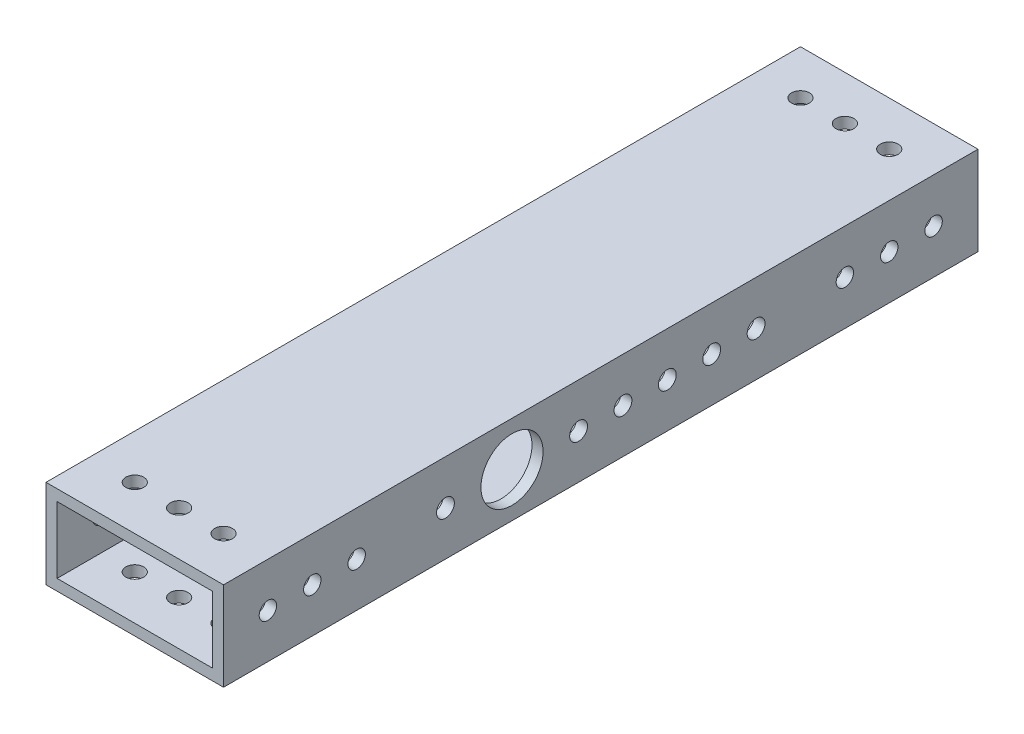
from build123d import *

# Parameters (mm, degrees)
SKETCH1_W           = 50.8
SKETCH1_H           = 25.4
SKETCH1_W_2         = 44.45
SKETCH1_H_2         = 19.05
BOSS_EXTRUDE1_DEPTH = 107.95
SKETCH3_R           = 2.5527
CUT_EXTRUDE2_DEPTH  = 114.769602707
SKETCH4_R           = 8.89
SKETCH4_R_2         = 2.5527
CUT_EXTRUDE3_DEPTH  = 120.979717036
SKETCH2_R           = 2.4892
CUT_EXTRUDE1_DEPTH  = 120.979717036
CUT_EXTRUDE4_REACH  = 115.77
SKETCH5_R           = 2.4892
CUT_EXTRUDE5_REACH  = 121.98
SKETCH7_R           = 2.5527


with BuildPart() as part:
    # Sketch1 → Boss-Extrude1 (new, symmetric)
    with BuildSketch(Plane.XY):
        Rectangle(SKETCH1_W, SKETCH1_H)
        Rectangle(SKETCH1_W_2, SKETCH1_H_2, mode=Mode.SUBTRACT)
    extrude(amount=BOSS_EXTRUDE1_DEPTH, both=True)

    # Sketch3 → Cut-Extrude2 (cut, through all)
    with BuildSketch(Plane(origin=(0, 12.7, 0), x_dir=(1, 0, 0), z_dir=(0, 1, 0))):
        with Locations((-12.7, -95.25)):
            Circle(SKETCH3_R)
        with Locations((0, -95.25)):
            Circle(SKETCH3_R)
        with Locations((12.7, -95.25)):
            Circle(SKETCH3_R)
        with Locations((12.7, 95.25)):
            Circle(SKETCH3_R)
        with Locations((0, 95.25)):
            Circle(SKETCH3_R)
        with Locations((-12.7, 95.25)):
            Circle(SKETCH3_R)
    extrude(amount=-CUT_EXTRUDE2_DEPTH, mode=Mode.SUBTRACT)

    # Sketch4 → Cut-Extrude3 (cut, through all)
    with BuildSketch(Plane(origin=(25.4, 0, 0), x_dir=(0, 0, -1), z_dir=(1, 0, 0))):
        with Locations((-25.4, 0)):
            Circle(SKETCH4_R)
        with Locations((31.75, 0)):
            Circle(SKETCH4_R_2)
        with Locations((19.05, 0)):
            Circle(SKETCH4_R_2)
    extrude(amount=-CUT_EXTRUDE3_DEPTH, mode=Mode.SUBTRACT)

    # Sketch2 → Cut-Extrude1 (cut, through all)
    with BuildSketch(Plane(origin=(25.4, 0, 0), x_dir=(0, 0, -1), z_dir=(1, 0, 0))):
        with Locations((-95.25, 0)):
            Circle(SKETCH2_R)
        with Locations((95.25, 0)):
            Circle(SKETCH2_R)
        with Locations((-82.55, 0)):
            Circle(SKETCH2_R)
        with Locations((-69.85, 0)):
            Circle(SKETCH2_R)
        with Locations((69.85, 0)):
            Circle(SKETCH2_R)
        with Locations((82.55, 0)):
            Circle(SKETCH2_R)
    extrude(amount=-CUT_EXTRUDE1_DEPTH, mode=Mode.SUBTRACT)

    # Sketch5 → Cut-Extrude4 (cut, up to next)
    with BuildSketch(Plane.XZ.offset(12.7), mode=Mode.PRIVATE) as cut_extrude4_sk1:
        with Locations((-3.81, 69.85)):
            Circle(SKETCH5_R)
    cut_extrude4_tool1 = extrude(cut_extrude4_sk1.sketch, amount=-CUT_EXTRUDE4_REACH, mode=Mode.PRIVATE) & part.part
    # Sketch5 → Cut-Extrude4 (cut, up to next)
    with BuildSketch(Plane.XZ.offset(12.7), mode=Mode.PRIVATE) as cut_extrude4_sk2:
        with Locations((-16.51, 69.85)):
            Circle(SKETCH5_R)
    cut_extrude4_tool2 = extrude(cut_extrude4_sk2.sketch, amount=-CUT_EXTRUDE4_REACH, mode=Mode.PRIVATE) & part.part
    # Sketch5 → Cut-Extrude4 (cut, up to next)
    with BuildSketch(Plane.XZ.offset(12.7), mode=Mode.PRIVATE) as cut_extrude4_sk3:
        with Locations((-16.51, 57.15)):
            Circle(SKETCH5_R)
    cut_extrude4_tool3 = extrude(cut_extrude4_sk3.sketch, amount=-CUT_EXTRUDE4_REACH, mode=Mode.PRIVATE) & part.part
    # Sketch5 → Cut-Extrude4 (cut, up to next)
    with BuildSketch(Plane.XZ.offset(12.7), mode=Mode.PRIVATE) as cut_extrude4_sk4:
        with Locations((-3.81, 57.15)):
            Circle(SKETCH5_R)
    cut_extrude4_tool4 = extrude(cut_extrude4_sk4.sketch, amount=-CUT_EXTRUDE4_REACH, mode=Mode.PRIVATE) & part.part
    # Sketch5 → Cut-Extrude4 (cut, up to next)
    with BuildSketch(Plane.XZ.offset(12.7), mode=Mode.PRIVATE) as cut_extrude4_sk5:
        with Locations((-3.81, -6.35)):
            Circle(SKETCH5_R)
    cut_extrude4_tool5 = extrude(cut_extrude4_sk5.sketch, amount=-CUT_EXTRUDE4_REACH, mode=Mode.PRIVATE) & part.part
    # Sketch5 → Cut-Extrude4 (cut, up to next)
    with BuildSketch(Plane.XZ.offset(12.7), mode=Mode.PRIVATE) as cut_extrude4_sk6:
        with Locations((-16.51, -6.35)):
            Circle(SKETCH5_R)
    cut_extrude4_tool6 = extrude(cut_extrude4_sk6.sketch, amount=-CUT_EXTRUDE4_REACH, mode=Mode.PRIVATE) & part.part
    # Sketch5 → Cut-Extrude4 (cut, up to next)
    with BuildSketch(Plane.XZ.offset(12.7), mode=Mode.PRIVATE) as cut_extrude4_sk7:
        with Locations((-16.51, -19.05)):
            Circle(SKETCH5_R)
    cut_extrude4_tool7 = extrude(cut_extrude4_sk7.sketch, amount=-CUT_EXTRUDE4_REACH, mode=Mode.PRIVATE) & part.part
    # Sketch5 → Cut-Extrude4 (cut, up to next)
    with BuildSketch(Plane.XZ.offset(12.7), mode=Mode.PRIVATE) as cut_extrude4_sk8:
        with Locations((-3.81, -19.05)):
            Circle(SKETCH5_R)
    cut_extrude4_tool8 = extrude(cut_extrude4_sk8.sketch, amount=-CUT_EXTRUDE4_REACH, mode=Mode.PRIVATE) & part.part
    add(cut_extrude4_tool1.solids().sort_by_distance((-3.81, -12.7, 69.85))[0], mode=Mode.SUBTRACT)
    add(cut_extrude4_tool2.solids().sort_by_distance((-16.51, -12.7, 69.85))[0], mode=Mode.SUBTRACT)
    add(cut_extrude4_tool3.solids().sort_by_distance((-16.51, -12.7, 57.15))[0], mode=Mode.SUBTRACT)
    add(cut_extrude4_tool4.solids().sort_by_distance((-3.81, -12.7, 57.15))[0], mode=Mode.SUBTRACT)
    add(cut_extrude4_tool5.solids().sort_by_distance((-3.81, -12.7, -6.35))[0], mode=Mode.SUBTRACT)
    add(cut_extrude4_tool6.solids().sort_by_distance((-16.51, -12.7, -6.35))[0], mode=Mode.SUBTRACT)
    add(cut_extrude4_tool7.solids().sort_by_distance((-16.51, -12.7, -19.05))[0], mode=Mode.SUBTRACT)
    add(cut_extrude4_tool8.solids().sort_by_distance((-3.81, -12.7, -19.05))[0], mode=Mode.SUBTRACT)

    # Sketch7 → Cut-Extrude5 (cut, up to next)
    with BuildSketch(Plane(origin=(25.4, 0, 0), x_dir=(0, 0, -1), z_dir=(1, 0, 0)), mode=Mode.PRIVATE) as cut_extrude5_sk1:
        with Locations((44.45, 0)):
            Circle(SKETCH7_R)
    cut_extrude5_tool1 = extrude(cut_extrude5_sk1.sketch, amount=-CUT_EXTRUDE5_REACH, mode=Mode.PRIVATE) & part.part
    # Sketch7 → Cut-Extrude5 (cut, up to next)
    with BuildSketch(Plane(origin=(25.4, 0, 0), x_dir=(0, 0, -1), z_dir=(1, 0, 0)), mode=Mode.PRIVATE) as cut_extrude5_sk2:
        with Locations((6.35, 0)):
            Circle(SKETCH7_R)
    cut_extrude5_tool2 = extrude(cut_extrude5_sk2.sketch, amount=-CUT_EXTRUDE5_REACH, mode=Mode.PRIVATE) & part.part
    # Sketch7 → Cut-Extrude5 (cut, up to next)
    with BuildSketch(Plane(origin=(25.4, 0, 0), x_dir=(0, 0, -1), z_dir=(1, 0, 0)), mode=Mode.PRIVATE) as cut_extrude5_sk3:
        with Locations((-6.35, 0)):
            Circle(SKETCH7_R)
    cut_extrude5_tool3 = extrude(cut_extrude5_sk3.sketch, amount=-CUT_EXTRUDE5_REACH, mode=Mode.PRIVATE) & part.part
    # Sketch7 → Cut-Extrude5 (cut, up to next)
    with BuildSketch(Plane(origin=(25.4, 0, 0), x_dir=(0, 0, -1), z_dir=(1, 0, 0)), mode=Mode.PRIVATE) as cut_extrude5_sk4:
        with Locations((-44.45, 0)):
            Circle(SKETCH7_R)
    cut_extrude5_tool4 = extrude(cut_extrude5_sk4.sketch, amount=-CUT_EXTRUDE5_REACH, mode=Mode.PRIVATE) & part.part
    add(cut_extrude5_tool1.solids().sort_by_distance((25.4, 0, -44.45))[0], mode=Mode.SUBTRACT)
    add(cut_extrude5_tool2.solids().sort_by_distance((25.4, 0, -6.35))[0], mode=Mode.SUBTRACT)
    add(cut_extrude5_tool3.solids().sort_by_distance((25.4, 0, 6.35))[0], mode=Mode.SUBTRACT)
    add(cut_extrude5_tool4.solids().sort_by_distance((25.4, 0, 44.45))[0], mode=Mode.SUBTRACT)


solid = part.part
